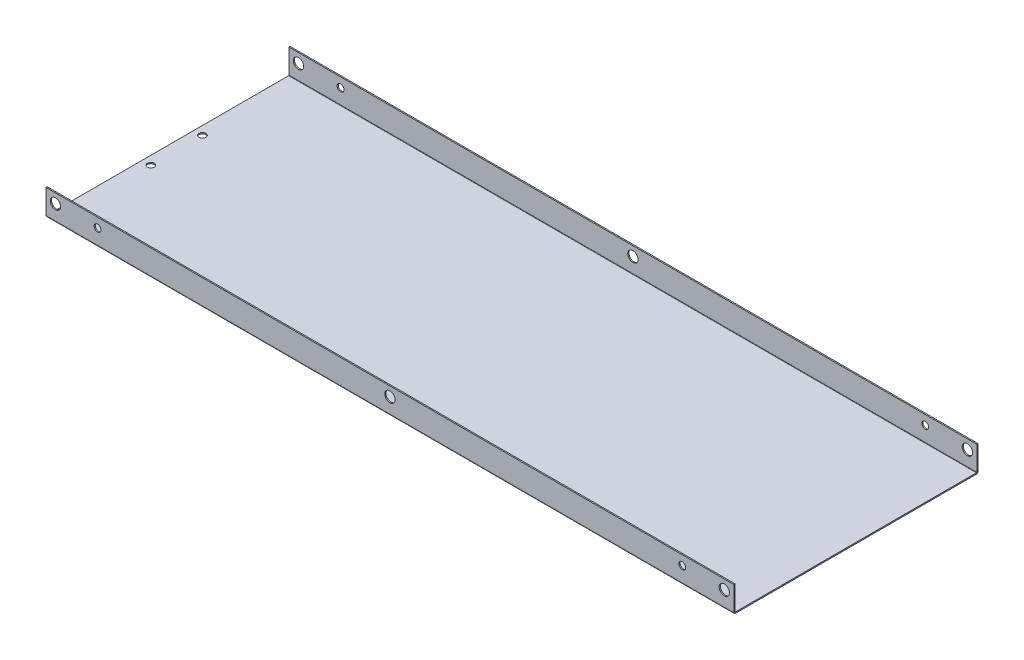
from build123d import *

# Parameters (mm, degrees)
SKETCH_1_W                         = 400
SKETCH_1_H                         = 142
SM_BASE_FLANGE_1_DEPTH             = 0.7
SM_EDGE_FLANGE_1_STRIP_W           = 3.2
SM_EDGE_FLANGE_1_STRIP_H           = 0.7
SM_EDGE_FLANGE_1_STRIP_CUT_DEPTH   = 400
SM_EDGE_FLANGE_1_STRIP_2_W         = 3.2
SM_EDGE_FLANGE_1_STRIP_2_H         = 0.7
SM_EDGE_FLANGE_1_STRIP_CUT_2_DEPTH = 400
SM_EDGE_FLANGE_1_DEPTH             = 400
SM_EDGE_FLANGE_1_BEND_DEPTH        = 400
SKETCH_17_R                        = 3
CUT_EXTRUDE_1_DEPTH                = 10
CUT_EXTRUDE_START                  = -10
SKETCH_18_R                        = 3
CUT_EXTRUDE_2_DEPTH                = 10
SKETCH_19_R                        = 2
CUT_EXTRUDE_3_DEPTH                = 10
SKETCH_20_R                        = 2
CUT_EXTRUDE_4_DEPTH                = 10
SKETCH_21_R                        = 2
CUT_EXTRUDE_5_DEPTH                = 10


# Sheet-metal steps are written as plain solids
with BuildPart() as part:
    # 草图1 → 基体-法兰1 (new body)
    with BuildSketch(Plane(origin=(0, 0, 0), x_dir=(1, 0, 0), z_dir=(0, 1, 0))):
        Rectangle(SKETCH_1_W, SKETCH_1_H)
    extrude(amount=-SM_BASE_FLANGE_1_DEPTH)

    # 边线-法兰1 strip (across the edge) → 边线-法兰1 strip cut (cut)
    with BuildSketch(Plane(origin=(200, 0, -71), x_dir=(0, 0, 1), z_dir=(-1, 0, 0))):
        with Locations((-0.7, -0.35)):
            Rectangle(SM_EDGE_FLANGE_1_STRIP_W, SM_EDGE_FLANGE_1_STRIP_H)
    extrude(amount=SM_EDGE_FLANGE_1_STRIP_CUT_DEPTH, mode=Mode.SUBTRACT)

    # 边线-法兰1 strip 2 (across the edge) → 边线-法兰1 strip cut 2 (cut)
    with BuildSketch(Plane(origin=(-200, 0, 71), x_dir=(0, 0, -1), z_dir=(1, 0, 0))):
        with Locations((-0.7, -0.35)):
            Rectangle(SM_EDGE_FLANGE_1_STRIP_2_W, SM_EDGE_FLANGE_1_STRIP_2_H)
    extrude(amount=SM_EDGE_FLANGE_1_STRIP_CUT_2_DEPTH, mode=Mode.SUBTRACT)

    # 边线-法兰1 section (across the edge) → 边线-法兰1 (add)
    with BuildSketch(Plane(origin=(200, 0, -71), x_dir=(0, 0, 1), z_dir=(-1, 0, 0))):
        with BuildLine():
            Line((0, 0.2), (0, 14.3))
            Line((0, 14.3), (0.7, 14.3))
            Line((0.7, 14.3), (0.7, 0.2))
            ThreePointArc((0.7, 0.2), (0.758578644, 0.058578644), (0.9, 0))
            Line((0.9, 0), (0.9, -0.7))
            ThreePointArc((0.9, -0.7), (0.263603897, -0.436396103), (0, 0.2))
        make_face()
    extrude(amount=SM_EDGE_FLANGE_1_DEPTH)

    # 边线-法兰1 section 2 (across the edge) → 边线-法兰1 bend (add)
    with BuildSketch(Plane(origin=(-200, 0, 71), x_dir=(0, 0, -1), z_dir=(1, 0, 0))):
        with BuildLine():
            Line((0, 0.2), (0, 14.3))
            Line((0, 14.3), (0.7, 14.3))
            Line((0.7, 14.3), (0.7, 0.2))
            ThreePointArc((0.7, 0.2), (0.758578644, 0.058578644), (0.9, 0))
            Line((0.9, 0), (0.9, -0.7))
            ThreePointArc((0.9, -0.7), (0.263603897, -0.436396103), (0, 0.2))
        make_face()
    extrude(amount=SM_EDGE_FLANGE_1_BEND_DEPTH)

    # 草图17 → 切除-拉伸1 (cut)
    with BuildSketch(Plane(origin=(0, 0, -71), x_dir=(-1, 0, 0), z_dir=(0, 0, -1))):
        with Locations(Location((-194.5, 8.8, 0), (0, 0, 90))):
            Circle(SKETCH_17_R)
        with Locations(Location((0, 8.8, 0), (0, 0, 90))):
            Circle(SKETCH_17_R)
        with Locations(Location((194.5, 8.8, 0), (0, 0, 270))):
            Circle(SKETCH_17_R)
    extrude(amount=-CUT_EXTRUDE_1_DEPTH, mode=Mode.SUBTRACT)

    # 草图18 → 切除-拉伸2 (cut)
    with BuildSketch(Plane.XY.offset(71).offset(CUT_EXTRUDE_START)):
        with Locations(Location((-194.5, 8.8, 0), (0, 0, 270))):
            Circle(SKETCH_18_R)
        with Locations(Location((0, 8.8, 0), (0, 0, 90))):
            Circle(SKETCH_18_R)
        with Locations(Location((194.5, 8.8, 0), (0, 0, 90))):
            Circle(SKETCH_18_R)
    extrude(amount=CUT_EXTRUDE_2_DEPTH, mode=Mode.SUBTRACT)

    # 草图19 → 切除-拉伸3 (cut)
    with BuildSketch(Plane(origin=(0, 0, -71), x_dir=(-1, 0, 0), z_dir=(0, 0, -1))):
        with Locations(Location((-170, 8.8, 0), (0, 0, 90))):
            Circle(SKETCH_19_R)
        with Locations(Location((170, 8.8, 0), (0, 0, 270))):
            Circle(SKETCH_19_R)
    extrude(amount=-CUT_EXTRUDE_3_DEPTH, mode=Mode.SUBTRACT)

    # 草图20 → 切除-拉伸4 (cut)
    with BuildSketch(Plane.XY.offset(71).offset(CUT_EXTRUDE_START)):
        with Locations(Location((-170, 8.8, 0), (0, 0, 270))):
            Circle(SKETCH_20_R)
        with Locations(Location((170, 8.8, 0), (0, 0, 90))):
            Circle(SKETCH_20_R)
    extrude(amount=CUT_EXTRUDE_4_DEPTH, mode=Mode.SUBTRACT)

    # 草图21 → 切除-拉伸5 (cut)
    with BuildSketch(Plane(origin=(0, 0, 0), x_dir=(1, 0, 0), z_dir=(0, 1, 0))):
        with Locations(Location((-195, 15, 0), (0, 0, 270))):
            Circle(SKETCH_21_R)
        with Locations(Location((-195, -15, 0), (0, 0, 90))):
            Circle(SKETCH_21_R)
    extrude(amount=-CUT_EXTRUDE_5_DEPTH, mode=Mode.SUBTRACT)


solid = part.part
